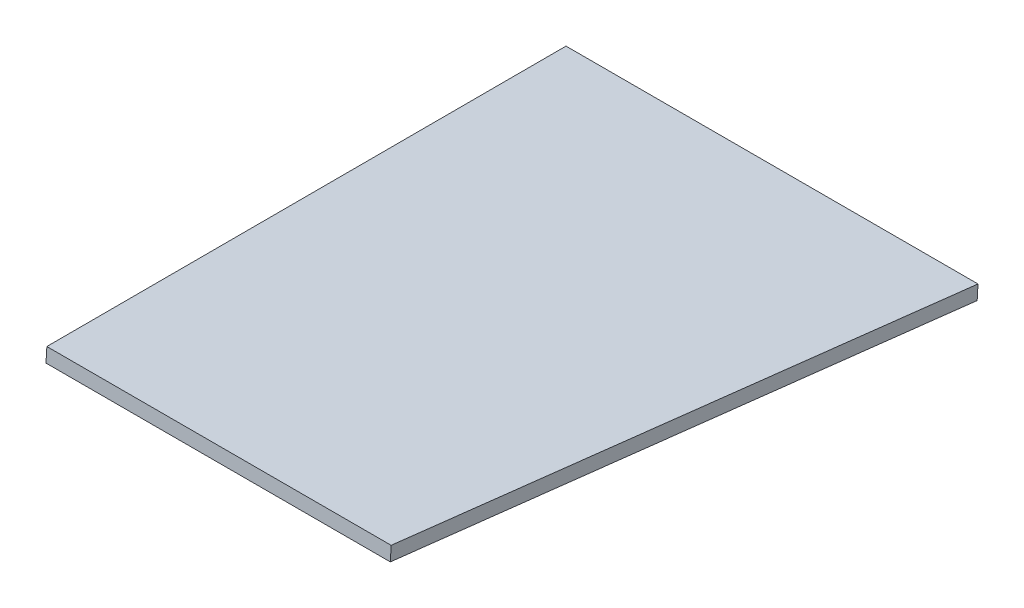
from build123d import *

# Parameters (mm, degrees)
BOSS_EXTRUDE1_DEPTH = 12.7


with BuildPart() as part:
    # PedalBox Floor → Boss-Extrude1 (new body)
    with BuildSketch(Plane(origin=(0, -11.912117549, 0.716369544), x_dir=(-1, 0, 0), z_dir=(0, -0.9981966075420028, 0.06002943187834598))):
        Polygon((379.761537954, -1353.007868005), (410.470933114, -1855.750165961), (722.92899612, -1855.750165961), (753.63839128, -1353.007868005), align=None)
    extrude(amount=BOSS_EXTRUDE1_DEPTH)


solid = part.part
